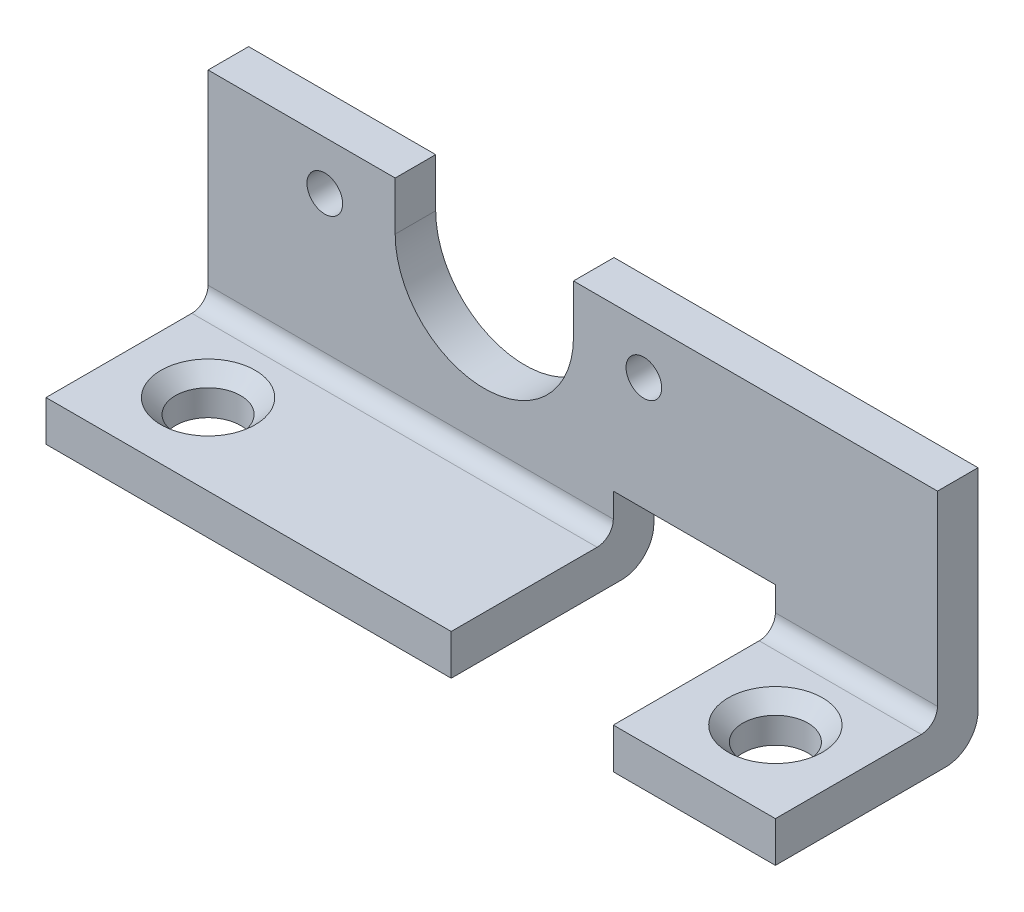
from build123d import *

# Parameters (mm, degrees)
SKETCH1_R           = 1.397
BOSS_EXTRUDE1_DEPTH = 3.175
SKETCH2_W           = 57.15
SKETCH2_H           = 12.7
SKETCH2_R           = 2.5527
BOSS_EXTRUDE2_DEPTH = 3.175
FILLET1_R           = 1.27
FILLET2_R           = 2.54
CHAMFER1_SIZE       = 1.143
SKETCH3_W           = 12.7
SKETCH3_H           = 6.35
CUT_EXTRUDE1_DEPTH  = 38.834491539


with BuildPart() as part:
    # Sketch1 → Boss-Extrude1 (new body)
    with BuildSketch(Plane.XY):
        with BuildLine():
            Line((-13.916, 15.24), (-13.916, 19.05))
            Line((-13.916, 19.05), (-28.575, 19.05))
            Line((-28.575, 19.05), (-28.575, 0))
            Line((-28.575, 0), (28.575, 0))
            Line((28.575, 0), (28.575, 19.05))
            Line((28.575, 19.05), (0.054, 19.05))
            Line((0.054, 19.05), (0.054, 15.24))
            ThreePointArc((0.054, 15.24), (-6.931, 8.255), (-13.916, 15.24))
        make_face()
        with Locations((5.569, 15.24)):
            Circle(SKETCH1_R, mode=Mode.SUBTRACT)
        with Locations((-19.431, 15.24)):
            Circle(SKETCH1_R, mode=Mode.SUBTRACT)
    extrude(amount=-BOSS_EXTRUDE1_DEPTH)

    # Sketch2 → Boss-Extrude2 (add)
    with BuildSketch(Plane(origin=(0, 0, 0), x_dir=(1, 0, 0), z_dir=(0, 1, 0))):
        with Locations((0, -6.35)):
            Rectangle(SKETCH2_W, SKETCH2_H)
        with Locations((-22.225, -6.35)):
            Circle(SKETCH2_R, mode=Mode.SUBTRACT)
        with Locations((22.225, -6.35)):
            Circle(SKETCH2_R, mode=Mode.SUBTRACT)
    extrude(amount=BOSS_EXTRUDE2_DEPTH)

    # Fillet1
    fillet1_edges = [part.edges().sort_by_distance(p)[0] for p in [
        (0, 3.175, 0),
    ]]
    fillet(fillet1_edges, radius=FILLET1_R)

    # Fillet2
    fillet2_edges = [part.edges().sort_by_distance(p)[0] for p in [
        (0, 0, -3.175),
    ]]
    fillet(fillet2_edges, radius=FILLET2_R)

    # Chamfer1
    chamfer1_edges = [part.edges().sort_by_distance(p)[0] for p in [
        (-24.7777, 3.175, 6.35),
        (19.6723, 3.175, 6.35),
    ]]
    chamfer(chamfer1_edges, length=CHAMFER1_SIZE)

    # Sketch3 → Cut-Extrude1 (cut, through all)
    with BuildSketch(Plane(origin=(0, 0, -3.175), x_dir=(-1, 0, 0), z_dir=(0, 0, -1))):
        with Locations((-9.525, 3.175)):
            Rectangle(SKETCH3_W, SKETCH3_H)
    extrude(amount=-CUT_EXTRUDE1_DEPTH, mode=Mode.SUBTRACT)


solid = part.part
